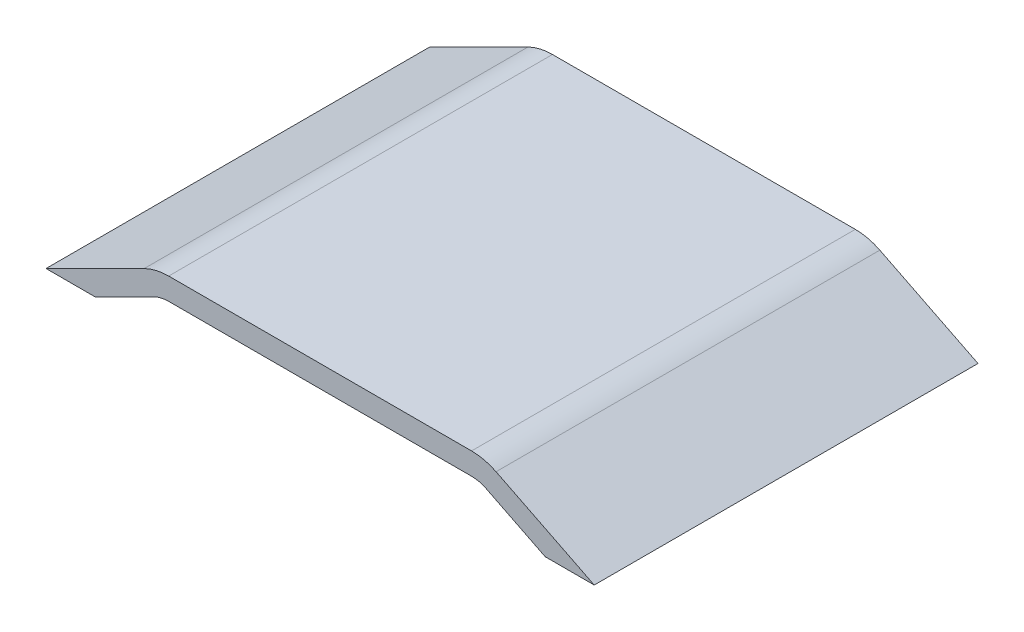
from build123d import *

# Parameters (mm, degrees)
BOSS_EXTRUDE1_DEPTH = 88.9
FILLET1_R           = 12.7
CUT_EXTRUDE1_REACH  = 111.434


with BuildPart() as part:
    # Sketch1 → Boss-Extrude1 (new body)
    with BuildSketch(Plane.XY):
        Polygon((-63.5, -6.35), (-38.07671882, 6.35), (38.07671882, 6.35), (63.5, -6.35), align=None)
    extrude(amount=BOSS_EXTRUDE1_DEPTH)

    # Fillet1
    fillet1_edges = [part.edges().sort_by_distance(p)[0] for p in [
        (-38.07671882, 6.35, 44.45),
        (38.07671882, 6.35, 44.45),
    ]]
    fillet(fillet1_edges, radius=FILLET1_R)

    # Sketch3 → Cut-Extrude1 (cut, up to next)
    with BuildSketch(Plane.XY.offset(88.9), mode=Mode.PRIVATE) as cut_extrude1_sk1:
        with BuildLine():
            Line((-61.229819732, -10.894522148), (61.229819732, -10.894522148))
            Line((61.229819732, -10.894522148), (38.48638186, 0.466783222))
            ThreePointArc((38.48638186, 0.466783222), (36.830470177, 1.066477875), (35.081111458, 1.27))
            Line((35.081111458, 1.27), (-35.081111458, 1.27))
            ThreePointArc((-35.081111458, 1.27), (-36.830470177, 1.066477875), (-38.48638186, 0.466783222))
            Line((-38.48638186, 0.466783222), (-61.229819732, -10.894522148))
        make_face()
    cut_extrude1_tool1 = extrude(cut_extrude1_sk1.sketch, amount=-CUT_EXTRUDE1_REACH, mode=Mode.PRIVATE) & part.part
    add(cut_extrude1_tool1.solids().sort_by_distance((0, -5.318132, 88.9))[0], mode=Mode.SUBTRACT)


solid = part.part
